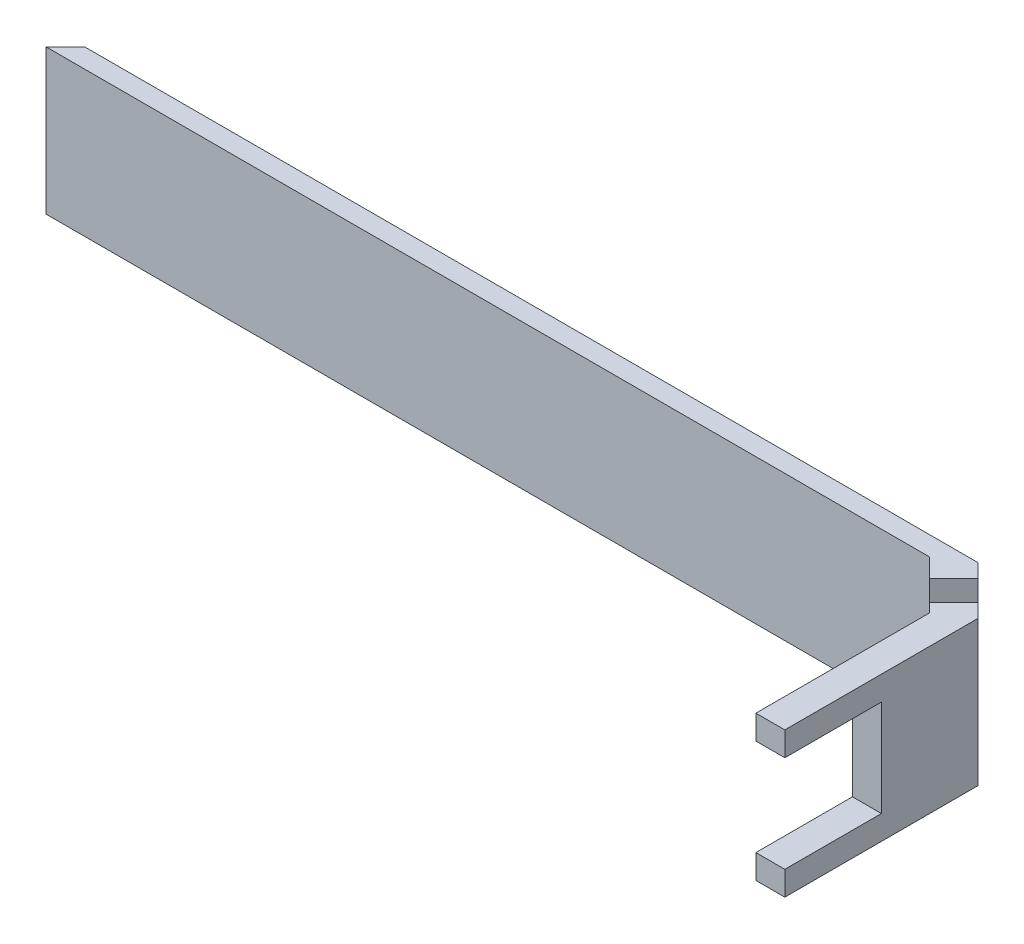
from build123d import *

# Parameters (mm, degrees)
BOSS_EXTRUDE1_DEPTH = 15
CHAMFER1_SIZE       = 5
SKETCH3_W           = 10
SKETCH3_H           = 10
CUT_EXTRUDE1_DEPTH  = 24
CHAMFER2_SIZE       = 2.5
SKETCH4_W           = 3
SKETCH4_H           = 3
CUT_EXTRUDE2_DEPTH  = 3.535533906


with BuildPart() as part:
    # Sketch1 → Boss-Extrude1 (new body)
    with BuildSketch(Plane(origin=(0, 0, 0), x_dir=(1, 0, 0), z_dir=(0, 1, 0))):
        Polygon((-48.5, 13.5), (51.5, 13.5), (51.5, -11.5), (48.5, -11.5), (48.5, 11.5), (-48.5, 11.5), align=None)
    extrude(amount=BOSS_EXTRUDE1_DEPTH)

    # Chamfer1
    chamfer1_edges = [part.edges().sort_by_distance(p)[0] for p in [
        (51.5, 7.5, -13.5),
        (48.5, 7.5, -11.5),
    ]]
    chamfer(chamfer1_edges, length=CHAMFER1_SIZE)

    # Sketch3 → Cut-Extrude1 (cut)
    with BuildSketch(Plane(origin=(51.5, 0, 0), x_dir=(0, 0, -1), z_dir=(1, 0, 0))):
        with Locations((-6.5, 7.5)):
            Rectangle(SKETCH3_W, SKETCH3_H)
    extrude(amount=-CUT_EXTRUDE1_DEPTH, mode=Mode.SUBTRACT)

    # Chamfer2
    # the kernel refuses this chamfer: 2.5 mm, written as the material it takes off along each edge
    with BuildSketch(Plane(origin=(-48.5, -6.42920747, -13.5), x_dir=(0.9996219169112968, 0, -0.027495876610586282), z_dir=(0, 1, 0))) as chamfer2_piece_1:
        Polygon((CHAMFER2_SIZE * 0.999621916911, -CHAMFER2_SIZE * 0.0274958766106), (-CHAMFER2_SIZE * 0.0274958766106, -CHAMFER2_SIZE * 0.999621916911), (0, 0), align=None)
    extrude(amount=27.85841494, mode=Mode.SUBTRACT)

    # Sketch4 → Cut-Extrude2 (cut)
    with BuildSketch(Plane(origin=(30, 0, -30), x_dir=(-0.7071067811865442, 0, -0.7071067811865509), z_dir=(0.7071067811865509, 0, -0.7071067811865442))):
        with Locations((-26.870057685, 1.5)):
            Rectangle(SKETCH4_W, SKETCH4_H)
        with Locations((-26.870057685, 13.5)):
            Rectangle(SKETCH4_W, SKETCH4_H)
    extrude(amount=-CUT_EXTRUDE2_DEPTH, mode=Mode.SUBTRACT)


solid = part.part
